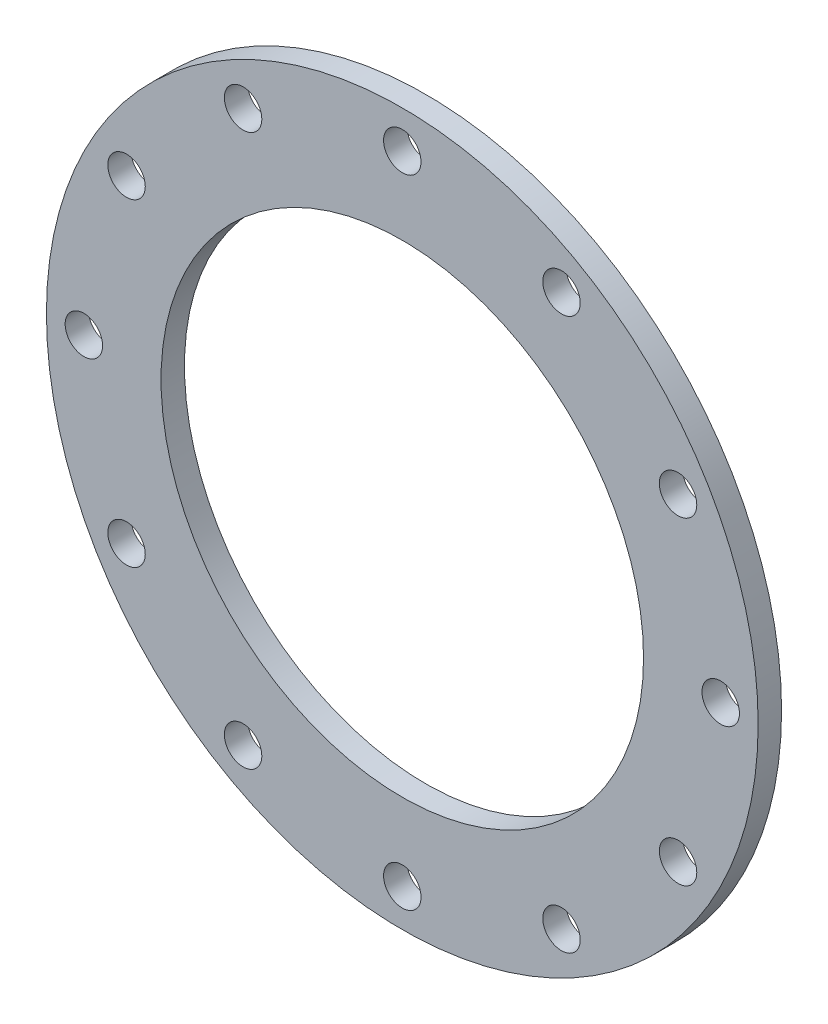
from build123d import *

# Parameters (mm, degrees)
PROFILE_SKETCH_R    = 241.3
PROFILE_SKETCH_R_2  = 163.576
PROFILE_SKETCH_R_3  = 12.7
BOSS_EXTRUDE1_DEPTH = 15.875


with BuildPart() as part:
    # Profile Sketch → Boss-Extrude1 (new body)
    with BuildSketch(Plane.XY):
        Circle(PROFILE_SKETCH_R)
        Circle(PROFILE_SKETCH_R_2, mode=Mode.SUBTRACT)
        with Locations((0, 215.9)):
            Circle(PROFILE_SKETCH_R_3, mode=Mode.SUBTRACT)
        with Locations((107.95, 186.974884677)):
            Circle(PROFILE_SKETCH_R_3, mode=Mode.SUBTRACT)
        with Locations((186.974884677, 107.95)):
            Circle(PROFILE_SKETCH_R_3, mode=Mode.SUBTRACT)
        with Locations((215.9, 0)):
            Circle(PROFILE_SKETCH_R_3, mode=Mode.SUBTRACT)
        with Locations((186.974884677, -107.95)):
            Circle(PROFILE_SKETCH_R_3, mode=Mode.SUBTRACT)
        with Locations((107.95, -186.974884677)):
            Circle(PROFILE_SKETCH_R_3, mode=Mode.SUBTRACT)
        with Locations((0, -215.9)):
            Circle(PROFILE_SKETCH_R_3, mode=Mode.SUBTRACT)
        with Locations((-107.95, -186.974884677)):
            Circle(PROFILE_SKETCH_R_3, mode=Mode.SUBTRACT)
        with Locations((-186.974884677, -107.95)):
            Circle(PROFILE_SKETCH_R_3, mode=Mode.SUBTRACT)
        with Locations((-215.9, 0)):
            Circle(PROFILE_SKETCH_R_3, mode=Mode.SUBTRACT)
        with Locations((-186.974884677, 107.95)):
            Circle(PROFILE_SKETCH_R_3, mode=Mode.SUBTRACT)
        with Locations((-107.95, 186.974884677)):
            Circle(PROFILE_SKETCH_R_3, mode=Mode.SUBTRACT)
    extrude(amount=BOSS_EXTRUDE1_DEPTH)


solid = part.part
